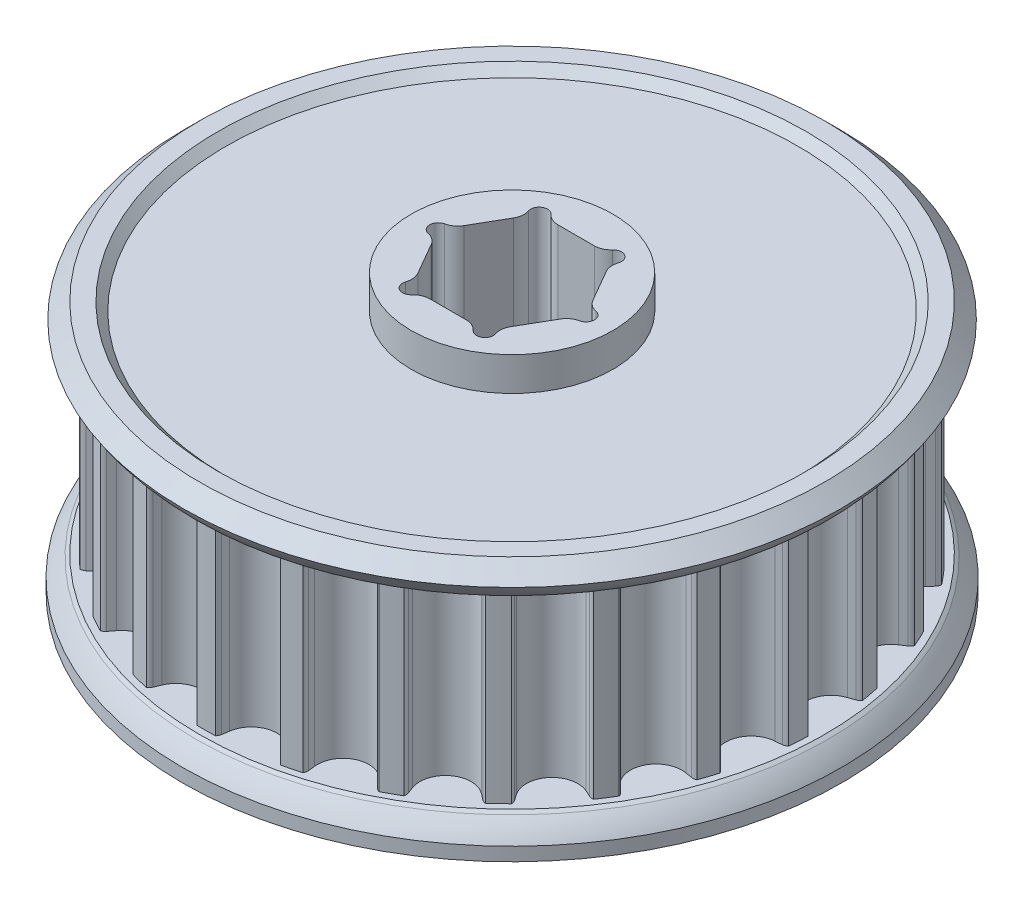
from build123d import *

# Parameters (mm, degrees)
SKETCH1_R           = 11.555621114
TOOTHOD_DEPTH       = 3.4925
TOOTHPROFILE_DEPTH  = 17.711143435
TOOTHPATTERN_COUNT  = 25
BORE_DEPTH          = 19.232350249
BORE_DEPTH_BACK     = 19.232350249
SKETCH11_R          = 7.9375
CUT_EXTRUDE1_DEPTH  = 0.3175
SKETCH10_R          = 3.81
BOSS_EXTRUDE1_DEPTH = 1.27
CHAMFER1_SIZE       = 3.175
CUT_EXTRUDE3_DEPTH  = 3.175
FILLET2_R           = 0.635
SKETCH12_R          = 0.3175
CUT_EXTRUDE2_DEPTH  = 21.4820701
FILLET1_R           = 0.635
CHAMFER2_SIZE       = 0.635


with BuildPart() as part:
    # Sketch1 → ToothOD (new, symmetric)
    with BuildSketch(Plane(origin=(0, 0, 0), x_dir=(1, 0, 0), z_dir=(0, 1, 0))):
        with Locations(Location((0, 0, 0), (0, 0, 270))):
            Circle(SKETCH1_R)
    extrude(amount=TOOTHOD_DEPTH, both=True)

    # Sketch2 → ToothProfile (cut, symmetric)
    with BuildSketch(Plane(origin=(0, 0, 0), x_dir=(1, 0, 0), z_dir=(0, 1, 0))):
        with BuildLine():
            ThreePointArc((-0.937033068, 11.10568311), (-0.590385173, 10.5875085), (0, 10.387221114))
            ThreePointArc((0, 10.387221114), (0.590385173, 10.5875085), (0.937033068, 11.10568311))
            ThreePointArc((0.937033068, 11.10568311), (0.971699064, 11.231794572), (1.007805813, 11.357501114))
            ThreePointArc((1.007805813, 11.357501114), (1.044604842, 11.43722658), (1.102929706, 11.502865964))
            ThreePointArc((1.102929706, 11.502865964), (0, 11.555621114), (-1.102929706, 11.502865964))
            ThreePointArc((-1.102929706, 11.502865964), (-1.044604842, 11.43722658), (-1.007805813, 11.357501114))
            ThreePointArc((-1.007805813, 11.357501114), (-0.971699064, 11.231794572), (-0.937033068, 11.10568311))
        make_face()
    toothprofile = extrude(amount=TOOTHPROFILE_DEPTH, both=True, mode=Mode.SUBTRACT)

    # ToothPattern: ToothProfile ×25 about axis
    toothpattern_axis = Axis((0, 0, 0), (0, 1, 0))
    for i in range(1, TOOTHPATTERN_COUNT):
        add(toothprofile.rotate(toothpattern_axis, i * 360 / TOOTHPATTERN_COUNT), mode=Mode.SUBTRACT)

    # Sketch4 → Flange (revolve)
    with BuildSketch(Plane.XY, mode=Mode.PRIVATE) as flange_sk:
        with BuildLine():
            Line((0, -3.4925), (11.809621114, -3.4925))
            ThreePointArc((11.809621114, -3.4925), (11.87383417, -3.537841157), (11.936621114, -3.585137424))
            ThreePointArc((11.936621114, -3.585137424), (12.212662712, -3.90309066), (12.444621114, -4.2545))
            Line((12.444621114, -4.2545), (12.444621114, -4.7625))
            Line((12.444621114, -4.7625), (0, -4.7625))
            Line((0, -4.7625), (0, -3.4925))
        make_face()
        with BuildLine():
            Line((12.444621114, 4.7625), (12.444621114, 4.2545))
            ThreePointArc((12.444621114, 4.2545), (12.212662712, 3.90309066), (11.936621114, 3.585137424))
            ThreePointArc((11.936621114, 3.585137424), (11.87383417, 3.537841157), (11.809621114, 3.4925))
            Line((11.809621114, 3.4925), (0, 3.4925))
            Line((0, 3.4925), (0, 4.7625))
            Line((0, 4.7625), (12.444621114, 4.7625))
        make_face()
    revolve(flange_sk.sketch.rotate(Axis((0, 8.73125, 0), (0, -1, 0)), 90), axis=Axis((0, 8.73125, 0), (0, -1, 0)))

    # Sketch7 → Bore (cut, two sides: drawn at the far end of the back side and taken through both)
    with BuildSketch(Plane.XZ.offset(-BORE_DEPTH_BACK)):
        Polygon((1.396812374, 2.41935), (-1.396812374, 2.41935), (-2.793624748, 0), (-1.396812374, -2.41935), (1.396812374, -2.41935), (2.793624748, 0), align=None)
    extrude(amount=BORE_DEPTH + BORE_DEPTH_BACK, mode=Mode.SUBTRACT)

    # Sketch11 → Cut-Extrude1 (cut)
    with BuildSketch(Plane(origin=(0, 4.7625, 0), x_dir=(1, 0, 0), z_dir=(0, 1, 0))):
        with Locations(Location((0, 0, 0), (0, 0, 270))):
            Circle(SKETCH11_R)
    extrude(amount=-CUT_EXTRUDE1_DEPTH, mode=Mode.SUBTRACT)

    # Sketch10 → Boss-Extrude1 (add)
    with BuildSketch(Plane(origin=(0, 4.445, 0), x_dir=(1, 0, 0), z_dir=(0, 1, 0))):
        with Locations(Location((0, 0, 0), (0, 0, 270))):
            Circle(SKETCH10_R)
        Polygon((1.396812374, -2.41935), (2.793624748, 0), (1.396812374, 2.41935), (-1.396812374, 2.41935), (-2.793624748, 0), (-1.396812374, -2.41935), align=None, mode=Mode.SUBTRACT)
    extrude(amount=BOSS_EXTRUDE1_DEPTH)

    # Chamfer1
    # the kernel refuses this chamfer: 3.175 mm, written as the material it takes off along each edge
    with BuildSketch(Plane(origin=(0, 4.7625, 0), x_dir=(0, 0, 1), z_dir=(-1, 0, 0))) as chamfer1_piece_1_section:
        Polygon((7.9375 + CHAMFER1_SIZE, 0), (7.9375, -CHAMFER1_SIZE), (7.9375, 0), align=None)
    chamfer1_piece_1 = revolve(axis=Axis((0, 4.7625, 0), (0, 1, 0)), mode=Mode.PRIVATE)
    chamfer1_piece_1 = split(chamfer1_piece_1, bisect_by=Plane(origin=(0, 4.445, -10.96903061), z_dir=(0, 1, 0)), keep=Keep.TOP, mode=Mode.PRIVATE)
    add(chamfer1_piece_1, mode=Mode.SUBTRACT)

    # Sketch13 → Cut-Extrude3 (cut)
    with BuildSketch(Plane.XZ.offset(4.7625)):
        Polygon((2.822954141, -4.8895), (5.645908282, 0), (2.822954141, 4.8895), (-2.822954141, 4.8895), (-5.645908282, 0), (-2.822954141, -4.8895), align=None)
    extrude(amount=-CUT_EXTRUDE3_DEPTH, mode=Mode.SUBTRACT)

    # Fillet2
    fillet2_edges = [part.edges().sort_by_distance(p)[0] for p in [
        (2.822954141, -3.175, -4.8895),
        (-2.822954141, -3.175, -4.8895),
        (-5.645908282, -3.175, 0),
        (-2.822954141, -3.175, 4.8895),
        (2.822954141, -3.175, 4.8895),
        (5.645908282, -3.175, 0),
    ]]
    fillet(fillet2_edges, radius=FILLET2_R)

    # Sketch12 → Cut-Extrude2 (cut, through all)
    with BuildSketch(Plane.XZ.offset(4.7625)):
        with Locations((1.396812374, 2.41935)):
            Circle(SKETCH12_R)
        with Locations((2.793624748, 0)):
            Circle(SKETCH12_R)
        with Locations((1.396812374, -2.41935)):
            Circle(SKETCH12_R)
        with Locations((-1.396812374, -2.41935)):
            Circle(SKETCH12_R)
        with Locations((-2.793624748, 0)):
            Circle(SKETCH12_R)
        with Locations((-1.396812374, 2.41935)):
            Circle(SKETCH12_R)
    extrude(amount=-CUT_EXTRUDE2_DEPTH, mode=Mode.SUBTRACT)

    # Fillet1
    fillet1_edges = [part.edges().sort_by_distance(p)[0] for p in [
        (-1.555562374, 2.06375, 2.144386934),
        (-1.079312374, 2.06375, 2.41935),
        (-2.634874748, 2.06375, -0.274963066),
        (-2.634874748, 2.06375, 0.274963066),
        (-1.079312374, 2.06375, -2.41935),
        (-1.555562374, 2.06375, -2.144386934),
        (1.555562374, 2.06375, -2.144386934),
        (1.079312374, 2.06375, -2.41935),
        (2.634874748, 2.06375, 0.274963066),
        (2.634874748, 2.06375, -0.274963066),
        (1.555562374, 2.06375, 2.144386934),
        (1.079312374, 2.06375, 2.41935),
    ]]
    fillet(fillet1_edges, radius=FILLET1_R)

    # Chamfer2
    # the kernel refuses this chamfer: 0.635 mm, written as the material it takes off along each edge
    with BuildSketch(Plane(origin=(0, 4.7625, 0), x_dir=(0, 0, 1), z_dir=(1, 0, 0))) as chamfer2_piece_1:
        Polygon((12.444621114 - CHAMFER2_SIZE, 0), (12.444621114, CHAMFER2_SIZE), (12.444621114, 0), align=None)
    revolve(axis=Axis((0, 4.7625, 0), (0, -1, 0)), mode=Mode.SUBTRACT)


solid = part.part
